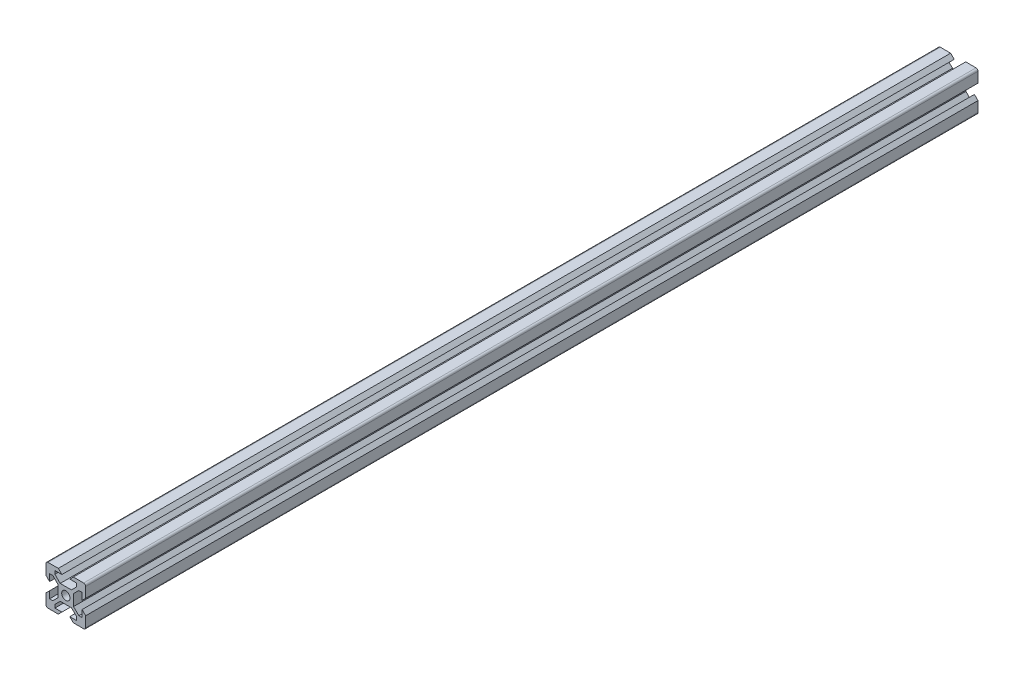
from build123d import *

# Parameters (mm, degrees)
SKETCH1_W           = 20
SKETCH1_H           = 20
SKETCH1_R           = 2.1
BOSS_EXTRUDE1_DEPTH = 450
CUT_EXTRUDE1_DEPTH  = 451.22216738
FILLET1_R           = 1
CHAMFER1_SIZE       = 1.8


with BuildPart() as part:
    # Sketch1 → Boss-Extrude1 (new body)
    with BuildSketch(Plane.XY):
        Rectangle(SKETCH1_W, SKETCH1_H)
        Circle(SKETCH1_R, mode=Mode.SUBTRACT)
    extrude(amount=BOSS_EXTRUDE1_DEPTH)

    # Sketch2 → Cut-Extrude1 (cut, through all)
    with BuildSketch(Plane(origin=(0, 0, 0), x_dir=(-1, 0, 0), z_dir=(0, 0, -1))):
        Polygon((-3.900660172, 2.84), (-3.900660172, -2.84), (-6.56, -5.499339828), (-8.2, -5.499339828), (-8.2, -2), (-10, -2), (-10, 2), (-8.2, 2), (-8.2, 5.499339828), (-6.56, 5.499339828), align=None)
        Polygon((5.499339828, 6.56), (2.84, 3.900660172), (-2.84, 3.900660172), (-5.499339828, 6.56), (-5.499339828, 8.2), (-2, 8.2), (-2, 10), (2, 10), (2, 8.2), (5.499339828, 8.2), align=None)
        Polygon((6.56, -5.499339828), (3.900660172, -2.84), (3.900660172, 2.84), (6.56, 5.499339828), (8.2, 5.499339828), (8.2, 2), (10, 2), (10, -2), (8.2, -2), (8.2, -5.499339828), align=None)
        Polygon((-5.499339828, -6.56), (-2.84, -3.900660172), (2.84, -3.900660172), (5.499339828, -6.56), (5.499339828, -8.2), (2, -8.2), (2, -10), (-2, -10), (-2, -8.2), (-5.499339828, -8.2), align=None)
    extrude(amount=-CUT_EXTRUDE1_DEPTH, mode=Mode.SUBTRACT)

    # Fillet1
    fillet1_edges = [part.edges().sort_by_distance(p)[0] for p in [
        (10, -10, 225),
        (-10, -10, 225),
        (-10, 10, 225),
        (10, 10, 225),
    ]]
    fillet(fillet1_edges, radius=FILLET1_R)

    # Chamfer1
    chamfer1_edges = [part.edges().sort_by_distance(p)[0] for p in [
        (10, 2, 225),
        (10, -2, 225),
        (2, -10, 225),
        (-2, -10, 225),
        (-10, -2, 225),
        (-10, 2, 225),
        (2, 10, 225),
        (-2, 10, 225),
    ]]
    chamfer(chamfer1_edges, length=CHAMFER1_SIZE - 0.0001)  # a hair under: the kernel refuses the full size


solid = part.part
